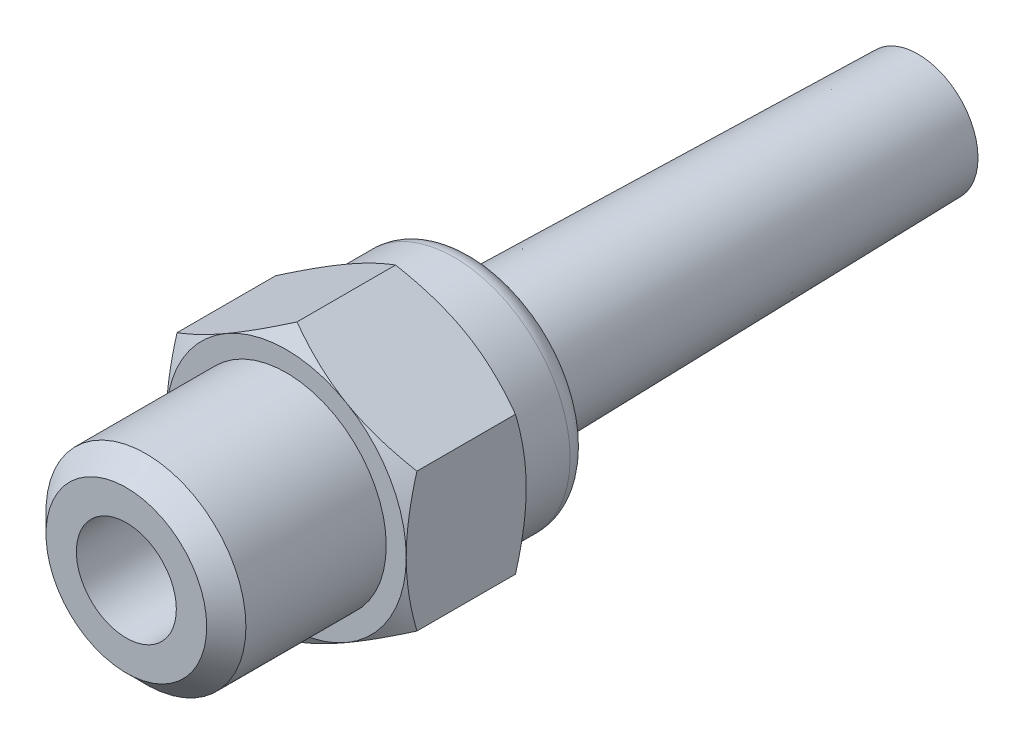
from build123d import *

# Parameters (mm, degrees)
SKETCH2_W          = 12
SKETCH2_H          = 12
CUT_EXTRUDE1_DEPTH = 3


with BuildPart() as part:
    # Sketch1 → Revolve1 (revolve)
    with BuildSketch(Plane(origin=(0, 0, 0), x_dir=(0, 0, -1), z_dir=(1, 0, 0))):
        with BuildLine():
            Line((4, 0), (4, 1.25))
            Line((4, 1.25), (0, 1.25))
            Line((0, 1.25), (0, 2.0095))
            Line((0, 2.0095), (0.4905, 2.5))
            Line((0.4905, 2.5), (4, 2.5))
            Line((4, 2.5), (4, 3))
            Line((4, 3), (4.346410162, 3.6))
            Line((4.346410162, 3.6), (6.653589838, 3.6))
            Line((6.653589838, 3.6), (7, 3))
            Line((7, 3), (7, 2.9))
            Line((7, 2.9), (8.2, 2.9))
            ThreePointArc((8.2, 2.9), (8.553553391, 2.753553391), (8.7, 2.4))
            Line((8.7, 2.4), (8.7, 1.7415))
            Line((8.7, 1.7415), (19.8, 1.5))
            Line((19.8, 1.5), (19.8, 0))
            Line((19.8, 0), (4, 0))
        make_face()
    revolve(axis=Axis((0, 0, -19.8), (0, 0, 1)))

    # Sketch2 → Cut-Extrude1 (cut)
    with BuildSketch(Plane.XY.offset(-4)):
        Rectangle(SKETCH2_W, SKETCH2_H)
        Polygon((-3, -1.732050808), (0, -3.464101615), (3, -1.732050808), (3, 1.732050808), (0, 3.464101615), (-3, 1.732050808), align=None, mode=Mode.SUBTRACT)
    extrude(amount=-CUT_EXTRUDE1_DEPTH, mode=Mode.SUBTRACT)


solid = part.part
